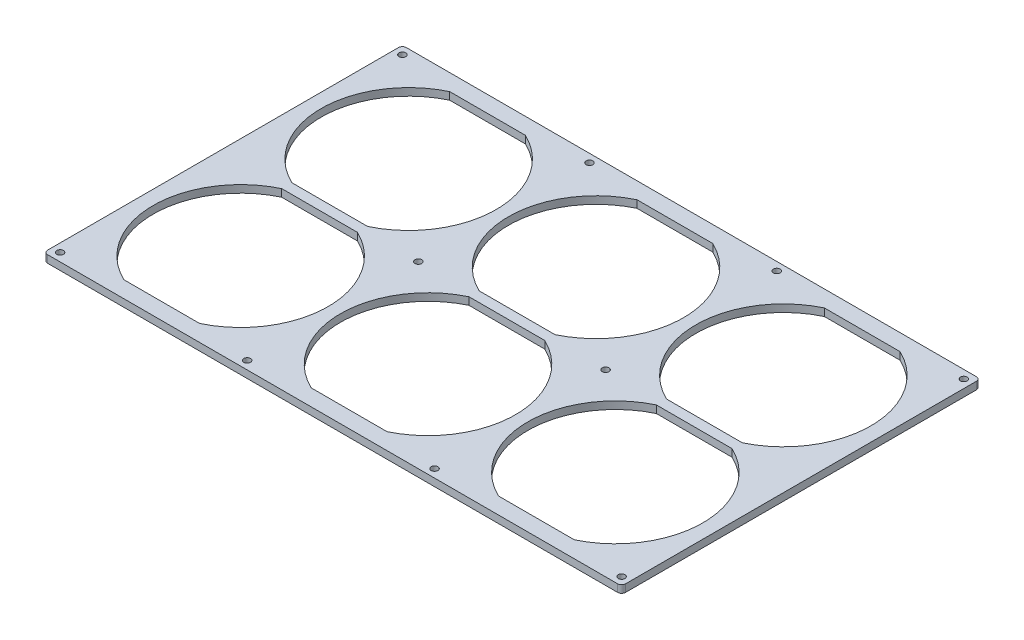
from build123d import *

# Parameters (mm, degrees)
SKETCH1_W             = 368.3
SKETCH1_H             = 228.6
BOSS_EXTRUDE1_DEPTH   = 4.7625
CUT_EXTRUDE1_DEPTH    = 217.791129676
SKETCH_PATTERN1_DEPTH = 4.7625
FILLET1_R             = 2.54
F_8_CLEARANCE_HOLE1_D = 4.3053


# Read off the part's stored shape, not the designer's step: Sketch-Pattern1
with BuildPart() as part:
    # Sketch1 → Boss-Extrude1 (new body)
    with BuildSketch(Plane(origin=(0, 0, 0), x_dir=(1, 0, 0), z_dir=(0, 1, 0))):
        Rectangle(SKETCH1_W, SKETCH1_H)
    extrude(amount=BOSS_EXTRUDE1_DEPTH)

    # Sketch3 → Cut-Extrude1 (cut, through all)
    with BuildSketch(Plane.XZ):
        with BuildLine():
            Line((143.533374481, -3.245454654), (95.226625519, -3.245454654))
            ThreePointArc((95.226625519, -3.245454654), (63.594954654, -53.5305), (95.226625519, -103.815545346))
            Line((95.226625519, -103.815545346), (143.533374481, -103.815545346))
            ThreePointArc((143.533374481, -103.815545346), (175.165045346, -53.5305), (143.533374481, -3.245454654))
        make_face()
    extrude(amount=-CUT_EXTRUDE1_DEPTH, mode=Mode.SUBTRACT)

    # Sketch-Pattern1 outline → Sketch-Pattern1 (cut)
    with BuildSketch(Plane(origin=(0, 0, 0), x_dir=(1, 0, 0), z_dir=(0, 1, 0))):
        with BuildLine():
            ThreePointArc((-24.153374481, 103.815545346), (-55.785045346, 53.5305), (-24.153374481, 3.245454654))
            Line((-24.153374481, 3.245454654), (24.153374481, 3.245454654))
            ThreePointArc((24.153374481, 3.245454654), (55.785045346, 53.5305), (24.153374481, 103.815545346))
            Line((24.153374481, 103.815545346), (-24.153374481, 103.815545346))
        make_face()
        with BuildLine():
            ThreePointArc((-143.533374481, 103.815545346), (-175.165045346, 53.5305), (-143.533374481, 3.245454654))
            Line((-143.533374481, 3.245454654), (-95.226625519, 3.245454654))
            ThreePointArc((-95.226625519, 3.245454654), (-63.594954654, 53.5305), (-95.226625519, 103.815545346))
            Line((-95.226625519, 103.815545346), (-143.533374481, 103.815545346))
        make_face()
        with BuildLine():
            ThreePointArc((95.226625519, -3.245454654), (63.594954654, -53.5305), (95.226625519, -103.815545346))
            Line((95.226625519, -103.815545346), (143.533374481, -103.815545346))
            ThreePointArc((143.533374481, -103.815545346), (175.165045346, -53.5305), (143.533374481, -3.245454654))
            Line((143.533374481, -3.245454654), (95.226625519, -3.245454654))
        make_face()
        with BuildLine():
            ThreePointArc((-24.153374481, -3.245454654), (-55.785045346, -53.5305), (-24.153374481, -103.815545346))
            Line((-24.153374481, -103.815545346), (24.153374481, -103.815545346))
            ThreePointArc((24.153374481, -103.815545346), (55.785045346, -53.5305), (24.153374481, -3.245454654))
            Line((24.153374481, -3.245454654), (-24.153374481, -3.245454654))
        make_face()
        with BuildLine():
            ThreePointArc((-143.533374481, -3.245454654), (-175.165045346, -53.5305), (-143.533374481, -103.815545346))
            Line((-143.533374481, -103.815545346), (-95.226625519, -103.815545346))
            ThreePointArc((-95.226625519, -103.815545346), (-63.594954654, -53.5305), (-95.226625519, -3.245454654))
            Line((-95.226625519, -3.245454654), (-143.533374481, -3.245454654))
        make_face()
    extrude(amount=SKETCH_PATTERN1_DEPTH, mode=Mode.SUBTRACT)

    # Fillet1
    fillet1_edges = [part.edges().sort_by_distance(p)[0] for p in [
        (184.15, 2.38125, 114.3),
        (-184.15, 2.38125, 114.3),
        (-184.15, 2.38125, -114.3),
        (184.15, 2.38125, -114.3),
    ]]
    fillet(fillet1_edges, radius=FILLET1_R)

    # #8 Clearance Hole1 (through all)
    with Locations(Plane(origin=(0, 0, 0), x_dir=(-1, 0, 0), z_dir=(0, -1, 0))):
        with Locations((-178.907772673, 109.057772673), (-59.69, 109.057772673), (59.69, 109.057772673), (178.907772673, 109.057772673), (178.907772673, -109.057772673), (59.69, -109.057772673), (-59.69, -109.057772673), (-178.907772673, -109.057772673), (59.69, 0), (-59.69, 0)):
            Hole(F_8_CLEARANCE_HOLE1_D / 2)


solid = part.part
